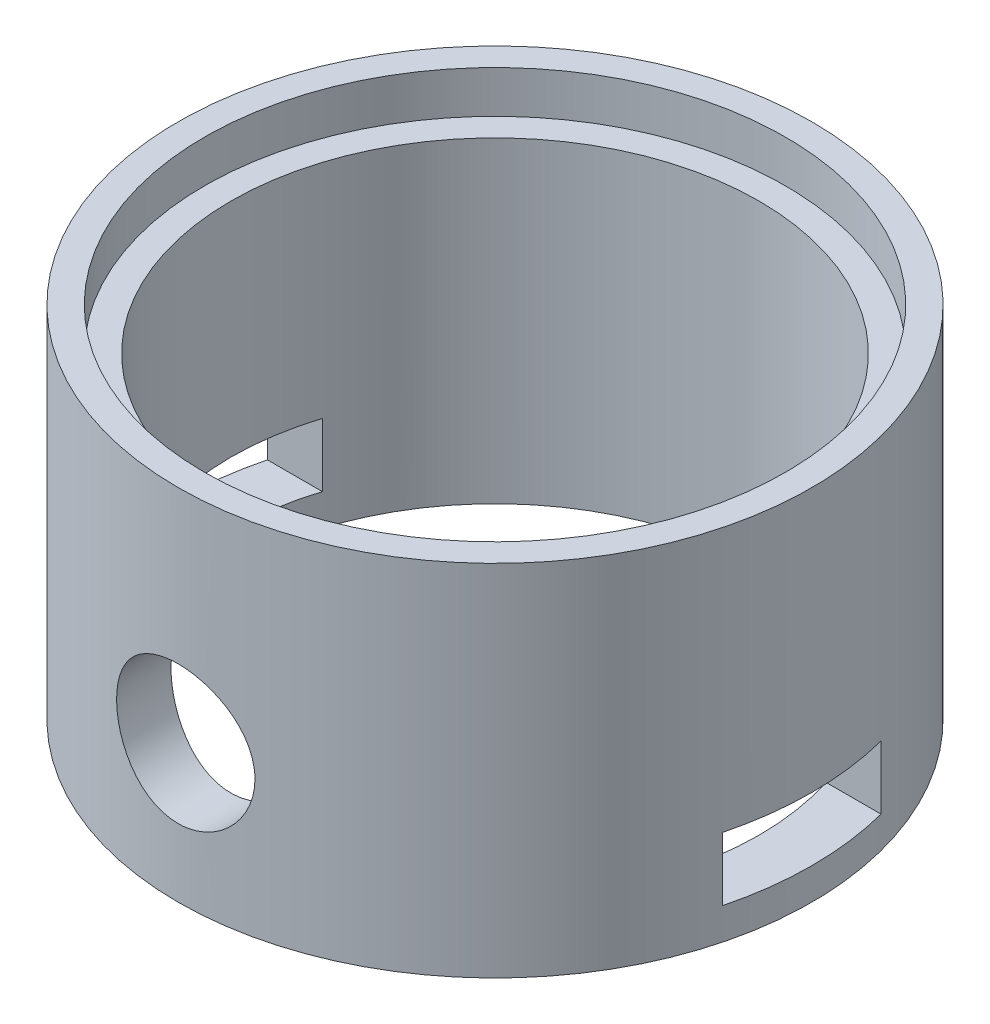
from build123d import *
from build123d.topology import SkipClean

# Parameters (mm, degrees)
SKETCH1_R                = 22.5
BOSS_EXTRUDE2_DEPTH      = 20
SKETCH3_R                = 20
CUT_EXTRUDE1_DEPTH       = 3
SKETCH7_W                = 55.028342564
SKETCH7_H                = 15.303936633
CUT_EXTRUDE5_DEPTH       = 40
SKETCH8_R                = 22.5
SKETCH8_R_2              = 20
BOSS_EXTRUDE3_DEPTH      = 25
SKETCH9_W                = 15
SKETCH9_H                = 6
CUT_EXTRUDE6_DEPTH       = 35
SKETCH18_R               = 7.5
SKETCH20_R               = 5
SKETCH22_R               = 6.55
CUT_EXTRUDE10_DEPTH      = 6
BOSS_EXTRUDE4_START      = 10
SKETCH23_R               = 8
SKETCH23_R_2             = 6.55
BOSS_EXTRUDE4_DEPTH      = 10
SKETCH24_R               = 0.5
SKETCH24_R_2             = 0.6
CUT_EXTRUDE11_DEPTH      = 49.023431953
BOSS_EXTRUDE9_START      = -33
SKETCH25_R               = 30
SKETCH25_R_2             = 22.5
BOSS_EXTRUDE9_DEPTH      = 33
CUT_EXTRUDE12_START      = 15
SKETCH27_R               = 6.55
CUT_EXTRUDE12_DEPTH      = 15
SKETCH30_R               = 25
SKETCH30_R_2             = 20
CUT_EXTRUDE17_DEPTH      = 3
SKETCH31_R               = 27.5
CUT_EXTRUDE18_DEPTH      = 3
SKETCH35_R               = 30
SKETCH35_R_2             = 27.5
BOSS_EXTRUDE11_DEPTH     = 1
CUT_EXTRUDE20_DEPTH      = 35
CUT_EXTRUDE20_DEPTH_BACK = 36
SKETCH37_W               = 15
SKETCH37_H               = 6
CUT_EXTRUDE21_START      = -23
SKETCH39_R               = 25
SKETCH39_R_2             = 20
CUT_EXTRUDE21_DEPTH      = 23
SKETCH40_R               = 8
SKETCH40_R_2             = 6.55
BOSS_EXTRUDE12_DEPTH     = 7
BOSS_EXTRUDE13_START     = 12
SKETCH41_R               = 8
SKETCH41_R_2             = 6.55
BOSS_EXTRUDE13_DEPTH     = 12
SKETCH44_R               = 25
CUT_EXTRUDE23_DEPTH      = 29
CUT_EXTRUDE24_START      = -62
SKETCH45_R               = 40.753020176
SKETCH45_R_2             = 30
CUT_EXTRUDE24_DEPTH      = 62


with BuildPart() as part:
    # Sketch1 → Boss-Extrude2 (new body)
    with BuildSketch(Plane(origin=(0, 0, 0), x_dir=(1, 0, 0), z_dir=(0, 1, 0))):
        Circle(SKETCH1_R)
    extrude(amount=BOSS_EXTRUDE2_DEPTH)

    # Sketch3 → Cut-Extrude1 (cut)
    with BuildSketch(Plane(origin=(0, 20, 0), x_dir=(1, 0, 0), z_dir=(0, 1, 0))):
        Circle(SKETCH3_R)
    extrude(amount=-CUT_EXTRUDE1_DEPTH, mode=Mode.SUBTRACT)

    # Sketch7 → Cut-Extrude5 (cut, symmetric)
    with BuildSketch(Plane.XY):
        with Locations((0.16574802, 4.348031684)):
            Rectangle(SKETCH7_W, SKETCH7_H)
    extrude(amount=CUT_EXTRUDE5_DEPTH, both=True, mode=Mode.SUBTRACT)

    # Sketch8 → Boss-Extrude3 (add)
    with BuildSketch(Plane.XZ.offset(-12)):
        Circle(SKETCH8_R)
        Circle(SKETCH8_R_2, mode=Mode.SUBTRACT)
    extrude(amount=BOSS_EXTRUDE3_DEPTH)

    # Sketch9 → Cut-Extrude6 (cut, symmetric)
    with BuildSketch(Plane(origin=(0, 0, 0), x_dir=(0, 0, -1), z_dir=(1, 0, 0))):
        with Locations((0, -7)):
            Rectangle(SKETCH9_W, SKETCH9_H)
    extrude(amount=CUT_EXTRUDE6_DEPTH, both=True, mode=Mode.SUBTRACT)

    # Sweep1: sweep along a path in Sketch17
    with BuildLine(Plane(origin=(0, 0, 0), x_dir=(0, 0, -1), z_dir=(1, 0, 0))) as sweep1_path:
        Line((-20, 0), (-18, 0))
        ThreePointArc((-18, 0), (-12.343145751, 2.343145751), (-10, 8))
        Line((-10, 8), (-10, 12))
    # Sketch18 → Sweep1 (sweep)
    with BuildSketch(Plane(origin=(0, 12, 0), x_dir=(1, 0, 0), z_dir=(0, 1, 0))):
        with Locations((0, -10)):
            Circle(SKETCH18_R)
    sweep(path=sweep1_path.line)

    # Cut-Sweep1: sweep along a path in Sketch21
    with BuildLine(Plane(origin=(0, 0, 0), x_dir=(0, 0, -1), z_dir=(1, 0, 0))) as cut_sweep1_path:
        Line((-10, 17), (-10, 8))
        ThreePointArc((-10, 8), (-12.343145751, 2.343145751), (-18, 0))
        Line((-18, 0), (-22.5, 0))
    # Sketch20 → Cut-Sweep1 (sweep, cut)
    with BuildSketch(Plane(origin=(0, 17, 0), x_dir=(1, 0, 0), z_dir=(0, 1, 0))):
        with Locations((0, -10)):
            Circle(SKETCH20_R)
    sweep(path=cut_sweep1_path.line, mode=Mode.SUBTRACT)

    # Sketch22 → Cut-Extrude10 (cut)
    with BuildSketch(Plane.XY.offset(23)):
        Circle(SKETCH22_R)
    extrude(amount=-CUT_EXTRUDE10_DEPTH, mode=Mode.SUBTRACT)

    # Sketch23 → Boss-Extrude4 (add)
    with BuildSketch(Plane.XY.offset(20).offset(BOSS_EXTRUDE4_START)):
        Circle(SKETCH23_R)
        Circle(SKETCH23_R_2, mode=Mode.SUBTRACT)
    extrude(amount=-BOSS_EXTRUDE4_DEPTH)

    # Sketch24 → Cut-Extrude11 (cut, through all)
    with BuildSketch(Plane(origin=(0, 17, 0), x_dir=(1, 0, 0), z_dir=(0, 1, 0))):
        with Locations((0.75, 0)):
            Circle(SKETCH24_R)
        with Locations((-0.75, 0)):
            Circle(SKETCH24_R)
        with Locations((-17.5, 0)):
            Circle(SKETCH24_R_2)
        with Locations((17.5, 0)):
            Circle(SKETCH24_R_2)
    extrude(amount=-CUT_EXTRUDE11_DEPTH, mode=Mode.SUBTRACT)

    # Sketch25 → Boss-Extrude9 (add)
    with SkipClean():  # the faces are left unmerged after this step: merging them gives an invalid solid
        with BuildSketch(Plane(origin=(0, 20, 0), x_dir=(1, 0, 0), z_dir=(0, 1, 0)).offset(BOSS_EXTRUDE9_START)):
            Circle(SKETCH25_R)
            Circle(SKETCH25_R_2, mode=Mode.SUBTRACT)
        extrude(amount=BOSS_EXTRUDE9_DEPTH)

    # Sketch27 → Cut-Extrude12 (cut)
    with SkipClean():  # the faces are left unmerged after this step: merging them gives an invalid solid
        with BuildSketch(Plane.XY.offset(17).offset(CUT_EXTRUDE12_START)):
            Circle(SKETCH27_R)
        extrude(amount=-CUT_EXTRUDE12_DEPTH, mode=Mode.SUBTRACT)

    # Sketch30 → Cut-Extrude17 (cut)
    with SkipClean():  # the faces are left unmerged after this step: merging them gives an invalid solid
        with BuildSketch(Plane(origin=(0, 20, 0), x_dir=(1, 0, 0), z_dir=(0, 1, 0))):
            Circle(SKETCH30_R)
            Circle(SKETCH30_R_2, mode=Mode.SUBTRACT)
        extrude(amount=-CUT_EXTRUDE17_DEPTH, mode=Mode.SUBTRACT)

    # Sketch31 → Cut-Extrude18 (cut)
    with SkipClean():  # the faces are left unmerged after this step: merging them gives an invalid solid
        with BuildSketch(Plane(origin=(0, 20, 0), x_dir=(1, 0, 0), z_dir=(0, 1, 0))):
            Circle(SKETCH31_R)
        extrude(amount=-CUT_EXTRUDE18_DEPTH, mode=Mode.SUBTRACT)

    # Sketch35 → Boss-Extrude11 (add)
    with SkipClean():  # the faces are left unmerged after this step: merging them gives an invalid solid
        with BuildSketch(Plane(origin=(0, 20, 0), x_dir=(1, 0, 0), z_dir=(0, 1, 0))):
            Circle(SKETCH35_R)
            Circle(SKETCH35_R_2, mode=Mode.SUBTRACT)
        extrude(amount=BOSS_EXTRUDE11_DEPTH)

    # Sketch37 → Cut-Extrude20 (cut, two sides: drawn at the far end of the back side and taken through both)
    with SkipClean():  # the faces are left unmerged after this step: merging them gives an invalid solid
        with BuildSketch(Plane(origin=(0, 0, 0), x_dir=(0, 0, -1), z_dir=(1, 0, 0)).offset(-CUT_EXTRUDE20_DEPTH_BACK)):
            with Locations((0, -7)):
                Rectangle(SKETCH37_W, SKETCH37_H)
        extrude(amount=CUT_EXTRUDE20_DEPTH + CUT_EXTRUDE20_DEPTH_BACK, mode=Mode.SUBTRACT)

    # Sketch39 → Cut-Extrude21 (cut)
    with SkipClean():  # the faces are left unmerged after this step: merging them gives an invalid solid
        with BuildSketch(Plane.XZ.offset(13).offset(CUT_EXTRUDE21_START)):
            Circle(SKETCH39_R)
            Circle(SKETCH39_R_2, mode=Mode.SUBTRACT)
        extrude(amount=CUT_EXTRUDE21_DEPTH, mode=Mode.SUBTRACT)

    # Sketch40 → Boss-Extrude12 (add)
    with SkipClean():  # the faces are left unmerged after this step: merging them gives an invalid solid
        with BuildSketch(Plane.XY.offset(23)):
            Circle(SKETCH40_R)
            Circle(SKETCH40_R_2, mode=Mode.SUBTRACT)
        extrude(amount=-BOSS_EXTRUDE12_DEPTH)

    # Sketch41 → Boss-Extrude13 (add)
    with BuildSketch(Plane.XY.offset(23).offset(BOSS_EXTRUDE13_START)):
        Circle(SKETCH41_R)
        Circle(SKETCH41_R_2, mode=Mode.SUBTRACT)
    extrude(amount=-BOSS_EXTRUDE13_DEPTH)

    # Sketch44 → Cut-Extrude23 (cut)
    with BuildSketch(Plane(origin=(0, 17, 0), x_dir=(1, 0, 0), z_dir=(0, 1, 0))):
        Circle(SKETCH44_R)
    extrude(amount=-CUT_EXTRUDE23_DEPTH, mode=Mode.SUBTRACT)

    # Sketch45 → Cut-Extrude24 (cut)
    with BuildSketch(Plane(origin=(0, 21, 0), x_dir=(1, 0, 0), z_dir=(0, 1, 0)).offset(CUT_EXTRUDE24_START)):
        Circle(SKETCH45_R)
        Circle(SKETCH45_R_2, mode=Mode.SUBTRACT)
    extrude(amount=CUT_EXTRUDE24_DEPTH, mode=Mode.SUBTRACT)


solid = part.part
